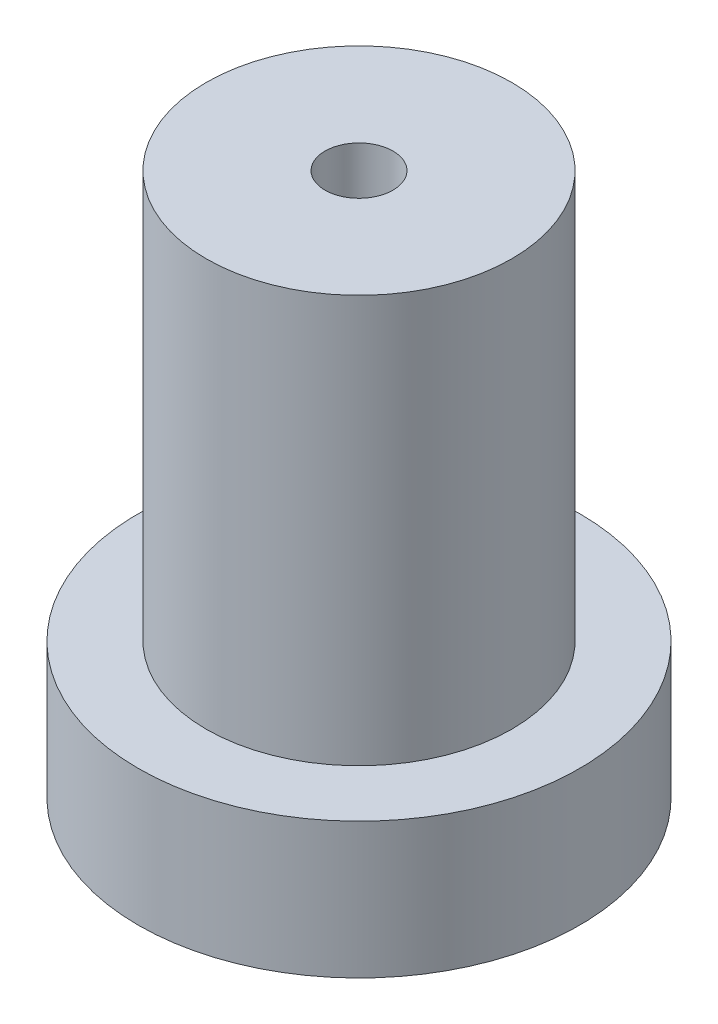
from build123d import *

# Parameters (mm, degrees)
SKETCH2_R          = 1
CUT_EXTRUDE1_DEPTH = 19.452642087


with BuildPart() as part:
    # Sketch1 → Revolve1 (revolve)
    with BuildSketch(Plane.XY):
        Polygon((0, -2), (6.5, -2), (6.5, 2), (4.5, 2), (4.5, 14), (0, 14), align=None)
    revolve(axis=Axis((0, 14, 0), (0, -1, 0)))

    # Sketch2 → Cut-Extrude1 (cut, through all)
    with BuildSketch(Plane.XZ.offset(2)):
        Circle(SKETCH2_R)
    extrude(amount=-CUT_EXTRUDE1_DEPTH, mode=Mode.SUBTRACT)


solid = part.part
